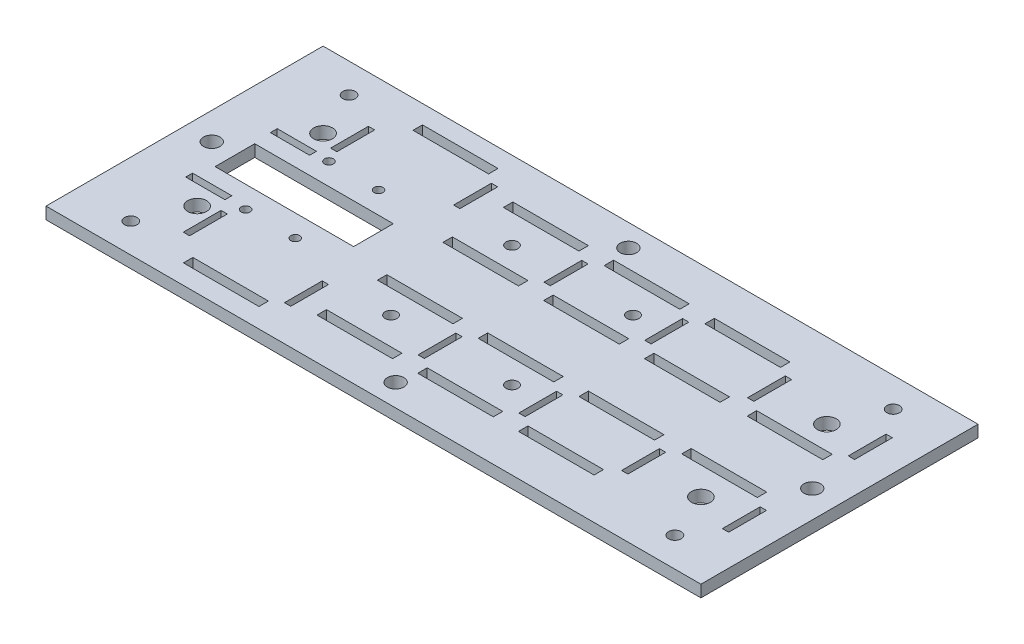
from build123d import *

# Parameters (mm, degrees)
SKETCH1_W           = 165.1
SKETCH1_H           = 69.85
BOSS_EXTRUDE1_DEPTH = 3
CUT_EXTRUDE1_REACH  = 91.684
SKETCH6_R           = 1.5
SKETCH6_W           = 34.925
SKETCH6_H           = 10
CUT_EXTRUDE3_REACH  = 91.684
SKETCH8_R           = 2.38125
SKETCH9_R           = 2.0828
CUT_EXTRUDE5_DEPTH  = 5.08
SKETCH10_R          = 2.0828
CUT_EXTRUDE6_DEPTH  = 5.08
SKETCH11_R          = 1.125
SKETCH11_R_2        = 1.125000036
CUT_EXTRUDE7_DEPTH  = 41.91
SKETCH12_W          = 19.05
SKETCH12_H          = 2.38125
SKETCH12_W_2        = 9.894876086
SKETCH12_H_2        = 1.732802182
SKETCH12_W_3        = 1.5875
SKETCH12_H_3        = 9.525
SKETCH12_H_4        = 1.732802181
CUT_EXTRUDE8_DEPTH  = 21.336
SKETCH13_R          = 1.5875
CUT_EXTRUDE10_DEPTH = 28.034


with BuildPart() as part:
    # Sketch1 → Boss-Extrude1 (new body)
    with BuildSketch(Plane(origin=(0, 0, 0), x_dir=(1, 0, 0), z_dir=(0, 1, 0))):
        Rectangle(SKETCH1_W, SKETCH1_H)
    extrude(amount=BOSS_EXTRUDE1_DEPTH)

    # Sketch6 → Cut-Extrude1 (cut, up to next)
    with BuildSketch(Plane.XZ, mode=Mode.PRIVATE) as cut_extrude1_sk1:
        with Locations((-15.25, 15.25)):
            Circle(SKETCH6_R)
    cut_extrude1_tool1 = extrude(cut_extrude1_sk1.sketch, amount=-CUT_EXTRUDE1_REACH, mode=Mode.PRIVATE) & part.part
    # Sketch6 → Cut-Extrude1 (cut, up to next)
    with BuildSketch(Plane.XZ, mode=Mode.PRIVATE) as cut_extrude1_sk2:
        with Locations((15.25, 15.25)):
            Circle(SKETCH6_R)
    cut_extrude1_tool2 = extrude(cut_extrude1_sk2.sketch, amount=-CUT_EXTRUDE1_REACH, mode=Mode.PRIVATE) & part.part
    # Sketch6 → Cut-Extrude1 (cut, up to next)
    with BuildSketch(Plane.XZ, mode=Mode.PRIVATE) as cut_extrude1_sk3:
        with Locations((-15.25, -15.25)):
            Circle(SKETCH6_R)
    cut_extrude1_tool3 = extrude(cut_extrude1_sk3.sketch, amount=-CUT_EXTRUDE1_REACH, mode=Mode.PRIVATE) & part.part
    # Sketch6 → Cut-Extrude1 (cut, up to next)
    with BuildSketch(Plane.XZ, mode=Mode.PRIVATE) as cut_extrude1_sk4:
        with Locations((15.25, -15.25)):
            Circle(SKETCH6_R)
    cut_extrude1_tool4 = extrude(cut_extrude1_sk4.sketch, amount=-CUT_EXTRUDE1_REACH, mode=Mode.PRIVATE) & part.part
    # Sketch6 → Cut-Extrude1 (cut, up to next)
    with BuildSketch(Plane.XZ, mode=Mode.PRIVATE) as cut_extrude1_sk5:
        with Locations((-52.3875, 0)):
            Rectangle(SKETCH6_W, SKETCH6_H)
    cut_extrude1_tool5 = extrude(cut_extrude1_sk5.sketch, amount=-CUT_EXTRUDE1_REACH, mode=Mode.PRIVATE) & part.part
    add(cut_extrude1_tool1.solids().sort_by_distance((-15.25, 0, 15.25))[0], mode=Mode.SUBTRACT)
    add(cut_extrude1_tool2.solids().sort_by_distance((15.25, 0, 15.25))[0], mode=Mode.SUBTRACT)
    add(cut_extrude1_tool3.solids().sort_by_distance((-15.25, 0, -15.25))[0], mode=Mode.SUBTRACT)
    add(cut_extrude1_tool4.solids().sort_by_distance((15.25, 0, -15.25))[0], mode=Mode.SUBTRACT)
    add(cut_extrude1_tool5.solids().sort_by_distance((-52.3875, 0, 0))[0], mode=Mode.SUBTRACT)

    # Sketch8 → Cut-Extrude3 (cut, up to next)
    with BuildSketch(Plane(origin=(0, 3, 0), x_dir=(1, 0, 0), z_dir=(0, 1, 0)), mode=Mode.PRIVATE) as cut_extrude3_sk1:
        with Locations((-63.5, -15.875)):
            Circle(SKETCH8_R)
    cut_extrude3_tool1 = extrude(cut_extrude3_sk1.sketch, amount=-CUT_EXTRUDE3_REACH, mode=Mode.PRIVATE) & part.part
    # Sketch8 → Cut-Extrude3 (cut, up to next)
    with BuildSketch(Plane(origin=(0, 3, 0), x_dir=(1, 0, 0), z_dir=(0, 1, 0)), mode=Mode.PRIVATE) as cut_extrude3_sk2:
        with Locations((-63.5, 15.875)):
            Circle(SKETCH8_R)
    cut_extrude3_tool2 = extrude(cut_extrude3_sk2.sketch, amount=-CUT_EXTRUDE3_REACH, mode=Mode.PRIVATE) & part.part
    # Sketch8 → Cut-Extrude3 (cut, up to next)
    with BuildSketch(Plane(origin=(0, 3, 0), x_dir=(1, 0, 0), z_dir=(0, 1, 0)), mode=Mode.PRIVATE) as cut_extrude3_sk3:
        with Locations((63.5, 15.875)):
            Circle(SKETCH8_R)
    cut_extrude3_tool3 = extrude(cut_extrude3_sk3.sketch, amount=-CUT_EXTRUDE3_REACH, mode=Mode.PRIVATE) & part.part
    # Sketch8 → Cut-Extrude3 (cut, up to next)
    with BuildSketch(Plane(origin=(0, 3, 0), x_dir=(1, 0, 0), z_dir=(0, 1, 0)), mode=Mode.PRIVATE) as cut_extrude3_sk4:
        with Locations((63.5, -15.875)):
            Circle(SKETCH8_R)
    cut_extrude3_tool4 = extrude(cut_extrude3_sk4.sketch, amount=-CUT_EXTRUDE3_REACH, mode=Mode.PRIVATE) & part.part
    add(cut_extrude3_tool1.solids().sort_by_distance((-63.5, 3, 15.875))[0], mode=Mode.SUBTRACT)
    add(cut_extrude3_tool2.solids().sort_by_distance((-63.5, 3, -15.875))[0], mode=Mode.SUBTRACT)
    add(cut_extrude3_tool3.solids().sort_by_distance((63.5, 3, -15.875))[0], mode=Mode.SUBTRACT)
    add(cut_extrude3_tool4.solids().sort_by_distance((63.5, 3, 15.875))[0], mode=Mode.SUBTRACT)

    # Sketch9 → Cut-Extrude5 (cut)
    with BuildSketch(Plane(origin=(0, 3, 0), x_dir=(1, 0, 0), z_dir=(0, 1, 0))):
        with Locations((-75.692, 0)):
            Circle(SKETCH9_R)
        with Locations((75.692, 0)):
            Circle(SKETCH9_R)
    extrude(amount=-CUT_EXTRUDE5_DEPTH, mode=Mode.SUBTRACT)

    # Sketch10 → Cut-Extrude6 (cut)
    with BuildSketch(Plane(origin=(0, 3, 0), x_dir=(1, 0, 0), z_dir=(0, 1, 0))):
        with Locations((0, -29.337)):
            Circle(SKETCH10_R)
        with Locations((0, 29.337)):
            Circle(SKETCH10_R)
    extrude(amount=-CUT_EXTRUDE6_DEPTH, mode=Mode.SUBTRACT)

    # Sketch11 → Cut-Extrude7 (cut)
    with BuildSketch(Plane(origin=(0, 3, 0), x_dir=(1, 0, 0), z_dir=(0, 1, 0))):
        with Locations((-56.6375, 10.5)):
            Circle(SKETCH11_R)
        with Locations((-44.1375, 10.5)):
            Circle(SKETCH11_R_2)
        with Locations((-44.1375, -10.5)):
            Circle(SKETCH11_R_2)
        with Locations((-56.6375, -10.5)):
            Circle(SKETCH11_R_2)
    extrude(amount=-CUT_EXTRUDE7_DEPTH, mode=Mode.SUBTRACT)

    # Sketch12 → Cut-Extrude8 (cut)
    with BuildSketch(Plane.XZ):
        with Locations((-15.071340952, 23.373504413)):
            Rectangle(SKETCH12_W, SKETCH12_H)
        with Locations((10.328659048, 23.373504413)):
            Rectangle(SKETCH12_W, SKETCH12_H)
        with Locations((35.728659048, 23.373504413)):
            Rectangle(SKETCH12_W, SKETCH12_H)
        with Locations((10.328659048, 8.133504413)):
            Rectangle(SKETCH12_W, SKETCH12_H)
        with Locations((35.728659048, 8.133504413)):
            Rectangle(SKETCH12_W, SKETCH12_H)
        with Locations((-15.071340952, 8.133504413)):
            Rectangle(SKETCH12_W, SKETCH12_H)
        with Locations((-66.323978982, 10.119491273)):
            Rectangle(SKETCH12_W_2, SKETCH12_H_2)
        with Locations((-15.071340952, -8.376495587)):
            Rectangle(SKETCH12_W, SKETCH12_H)
        with Locations((35.728659048, -8.376495587)):
            Rectangle(SKETCH12_W, SKETCH12_H)
        with Locations((10.328659048, -8.376495587)):
            Rectangle(SKETCH12_W, SKETCH12_H)
        with Locations((35.728659048, -23.616495587)):
            Rectangle(SKETCH12_W, SKETCH12_H)
        with Locations((10.328659048, -23.616495587)):
            Rectangle(SKETCH12_W, SKETCH12_H)
        with Locations((-15.071340952, -23.616495587)):
            Rectangle(SKETCH12_W, SKETCH12_H)
        with Locations((23.028659048, 15.753504413)):
            Rectangle(SKETCH12_W_3, SKETCH12_H_3)
        with Locations((-2.371340952, 15.753504413)):
            Rectangle(SKETCH12_W_3, SKETCH12_H_3)
        with Locations((-2.371340952, -15.996495587)):
            Rectangle(SKETCH12_W_3, SKETCH12_H_3)
        with Locations((23.028659048, -15.996495587)):
            Rectangle(SKETCH12_W_3, SKETCH12_H_3)
        with Locations((61.214571176, 7.709998323)):
            Rectangle(SKETCH12_W, SKETCH12_H)
        with Locations((-65.364631792, -10.256675963)):
            Rectangle(SKETCH12_W_2, SKETCH12_H_4)
        with Locations((61.214571176, -8.800001677)):
            Rectangle(SKETCH12_W, SKETCH12_H)
        with Locations((73.914571176, 15.329998323)):
            Rectangle(SKETCH12_W_3, SKETCH12_H_3)
        with Locations((48.514571176, 15.329998323)):
            Rectangle(SKETCH12_W_3, SKETCH12_H_3)
        with Locations((48.514571176, -16.420001677)):
            Rectangle(SKETCH12_W_3, SKETCH12_H_3)
        with Locations((73.914571176, -16.420001677)):
            Rectangle(SKETCH12_W_3, SKETCH12_H_3)
        with Locations((-43.304102612, -29.062103326)):
            Rectangle(SKETCH12_W, SKETCH12_H)
        with Locations((-58.532793167, -18.363697432)):
            Rectangle(SKETCH12_W_3, SKETCH12_H_3)
        with Locations((-30.604102612, -21.442103326)):
            Rectangle(SKETCH12_W_3, SKETCH12_H_3)
        with Locations((-30.604102612, 21.199112152)):
            Rectangle(SKETCH12_W_3, SKETCH12_H_3)
        with Locations((-58.752679303, 18.560478529)):
            Rectangle(SKETCH12_W_3, SKETCH12_H_3)
        with Locations((-43.304102612, 28.819112152)):
            Rectangle(SKETCH12_W, SKETCH12_H)
    extrude(amount=-CUT_EXTRUDE8_DEPTH, mode=Mode.SUBTRACT)

    # Sketch13 → Cut-Extrude10 (cut)
    with BuildSketch(Plane.XZ):
        with Locations((-68.580370043, 27.514580758)):
            Circle(SKETCH13_R)
        with Locations((-68.580370043, -27.514580758)):
            Circle(SKETCH13_R)
        with Locations((68.580370043, -27.514580758)):
            Circle(SKETCH13_R)
        with Locations((68.580370043, 27.514580758)):
            Circle(SKETCH13_R)
    extrude(amount=-CUT_EXTRUDE10_DEPTH, mode=Mode.SUBTRACT)


solid = part.part
